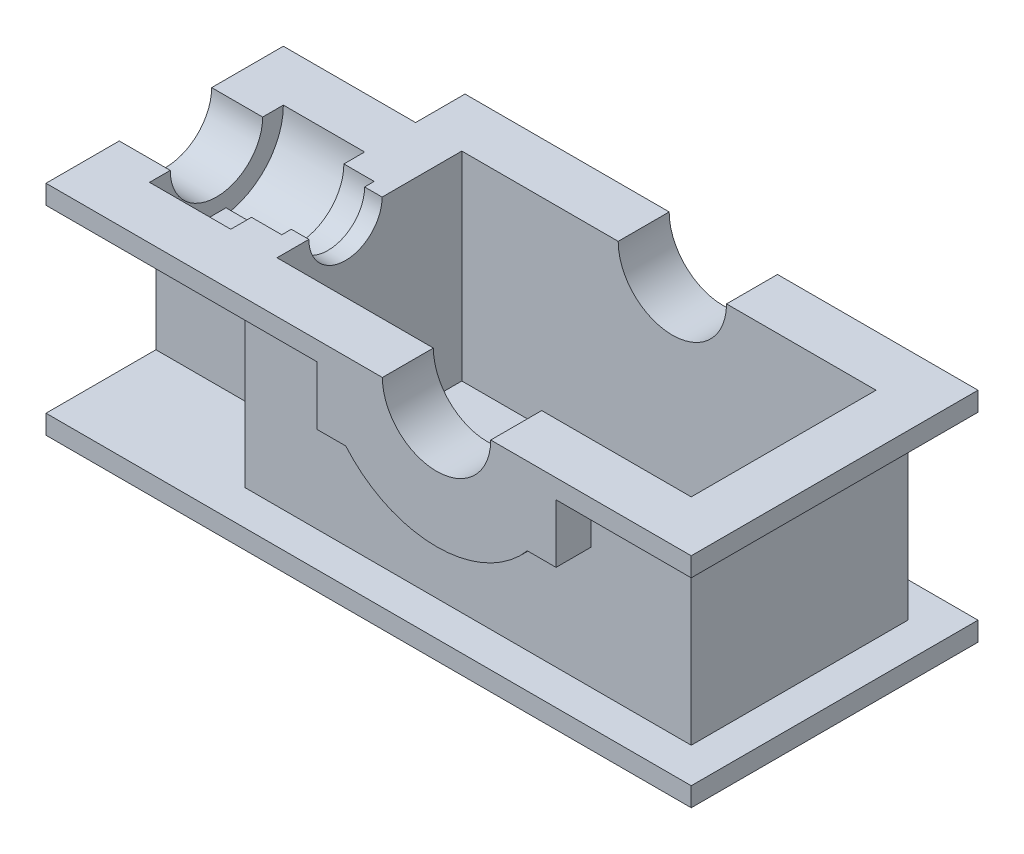
from build123d import *

# Parameters (mm, degrees)
EXTRUDE_1_DEPTH     = 12
SKETCH_2_W          = 150
SKETCH_2_H          = 32
SKETCH_2_W_2        = 30
SKETCH_2_H_2        = 98
SKETCH_2_W_3        = 32
EXTRUDE_2_DEPTH     = 250
SKETCH_3_R          = 34
CUT_EXTRUDE_1_DEPTH = 180
SKETCH_5_R          = 29
CUT_EXTRUDE_2_DEPTH = 102
SKETCH_7_R          = 23
CUT_EXTRUDE_3_DEPTH = 30
SKETCH_8_W          = 496.089150523
SKETCH_8_H          = 225.419588898
CUT_EXTRUDE_4_DEPTH = 125
EXTRUDE_4_DEPTH     = 12
EXTRUDE_5_DEPTH     = 125
EXTRUDE_6_DEPTH     = 83
CUT_EXTRUDE_5_DEPTH = 103
SKETCH_16_W         = 12
SKETCH_16_H         = 87.151966458
EXTRUDE_7_DEPTH     = 103
CUT_EXTRUDE_6_DEPTH = 22
CUT_EXTRUDE_START   = -22
CUT_EXTRUDE_7_DEPTH = 22


with BuildPart() as part:
    # Эскиз1 → Бобышка-Вытянуть1 (new body)
    with BuildSketch(Plane(origin=(0, 0, 0), x_dir=(1, 0, 0), z_dir=(0, 1, 0))):
        Polygon((0, 0), (313.861619332, 0), (313.861619332, 180), (-8.138380668, 180), (-8.138380668, 148.982), (-91.138380668, 148.982), (-91.138380668, 0), align=None)
    extrude(amount=EXTRUDE_1_DEPTH)

    # Эскиз2 → Бобышка-Вытянуть2 (add)
    with BuildSketch(Plane(origin=(0, 12, 0), x_dir=(1, 0, 0), z_dir=(0, 1, 0))):
        with Locations((154.012619332, 16)):
            Rectangle(SKETCH_2_W, SKETCH_2_H)
        with Locations((154.012619332, 164)):
            Rectangle(SKETCH_2_W, SKETCH_2_H)
        with Locations((6.861619332, 74.982)):
            Rectangle(SKETCH_2_W_2, SKETCH_2_H_2)
        with Locations((-75.138380668, 74.982)):
            Rectangle(SKETCH_2_W_3, SKETCH_2_H_2)
    extrude(amount=EXTRUDE_2_DEPTH)

    # Эскиз3 → Вырез-Вытянуть1 (cut)
    with BuildSketch(Plane.XY):
        with Locations((154.012619332, 137)):
            Circle(SKETCH_3_R)
    extrude(amount=-CUT_EXTRUDE_1_DEPTH, mode=Mode.SUBTRACT)

    # Эскиз5 → Вырез-Вытянуть2 (cut)
    with BuildSketch(Plane.ZY.offset(91.138380668)):
        with Locations((-74.982, 137)):
            Circle(SKETCH_5_R)
    extrude(amount=-CUT_EXTRUDE_2_DEPTH, mode=Mode.SUBTRACT)

    # Эскиз7 → Вырез-Вытянуть3 (cut)
    with BuildSketch(Plane(origin=(21.861619332, 0, 0), x_dir=(0, 0, -1), z_dir=(1, 0, 0))):
        with Locations((74.982, 137)):
            Circle(SKETCH_7_R)
    extrude(amount=-CUT_EXTRUDE_3_DEPTH, mode=Mode.SUBTRACT)

    # Эскиз8 → Вырез-Вытянуть4 (cut)
    with BuildSketch(Plane(origin=(0, 262, 0), x_dir=(1, 0, 0), z_dir=(0, 1, 0))):
        with Locations((147.686138723, 78.998859842)):
            Rectangle(SKETCH_8_W, SKETCH_8_H)
    extrude(amount=-CUT_EXTRUDE_4_DEPTH, mode=Mode.SUBTRACT)

    # Эскиз9 → Бобышка-Вытянуть4 (add)
    with BuildSketch(Plane(origin=(0, 137, 0), x_dir=(1, 0, 0), z_dir=(0, 1, 0))):
        Polygon((120.012619332, 0), (120.012619332, 32), (21.861619332, 32), (21.861619332, 32.982), (-91.138380668, 32.982), (-91.138380668, 0), align=None)
        Polygon((281.861619332, 32), (188.012619332, 32), (188.012619332, 0), (313.861619332, 0), (313.861619332, 180), (188.012619332, 180), (188.012619332, 148), (281.861619332, 148), align=None)
        Polygon((-8.138380668, 148.982), (-91.138380668, 148.982), (-91.138380668, 116.982), (21.861619332, 116.982), (21.861619332, 148), (120.012619332, 148), (120.012619332, 180), (-8.138380668, 180), align=None)
    extrude(amount=-EXTRUDE_4_DEPTH)

    # Эскиз10 → Бобышка-Вытянуть5 (add)
    with BuildSketch(Plane(origin=(0, 137, 0), x_dir=(1, 0, 0), z_dir=(0, 1, 0))):
        Polygon((21.861619332, 148), (120.012619332, 148), (120.012619332, 158), (11.861619332, 158), (11.861619332, 97.982), (21.861619332, 97.982), align=None)
        Polygon((21.861619332, 32), (21.861619332, 51.982), (11.861619332, 51.982), (11.861619332, 22), (120.012619332, 22), (120.012619332, 32), align=None)
        Polygon((281.861619332, 32), (188.012619332, 32), (188.012619332, 22), (291.861619332, 22), (291.861619332, 158), (188.012619332, 158), (188.012619332, 148), (281.861619332, 148), align=None)
    extrude(amount=-EXTRUDE_5_DEPTH)

    # Эскиз12 → Бобышка-Вытянуть6 (add)
    with BuildSketch(Plane.ZY.offset(91.138380668)):
        with BuildLine():
            Line((-121.982, 137), (-116.982, 137))
            ThreePointArc((-116.982, 137), (-74.982, 95), (-32.982, 137))
            Line((-32.982, 137), (-27.982, 137))
            ThreePointArc((-27.982, 137), (-74.982, 90), (-121.982, 137))
        make_face()
    extrude(amount=-EXTRUDE_6_DEPTH)

    # Эскиз14 → Вырез-Вытянуть5 (cut)
    with BuildSketch(Plane.ZY.offset(91.138380668)):
        with BuildLine():
            Line((-120.42427107, 125), (-123.982, 125))
            Line((-123.982, 125), (-123.982, 12))
            Line((-123.982, 12), (-25.982, 12))
            Line((-25.982, 12), (-25.982, 125))
            Line((-25.982, 125), (-29.53972893, 125))
            ThreePointArc((-29.53972893, 125), (-74.982, 90), (-120.42427107, 125))
        make_face()
    extrude(amount=-CUT_EXTRUDE_5_DEPTH, mode=Mode.SUBTRACT)

    # Эскиз16 → Бобышка-Вытянуть7 (add)
    with BuildSketch(Plane.ZY.offset(91.138380668)):
        with Locations((-74.982, 55.575983229)):
            Rectangle(SKETCH_16_W, SKETCH_16_H)
    extrude(amount=-EXTRUDE_7_DEPTH)

    # Эскиз17 → Вырез-Вытянуть6 (cut)
    with BuildSketch(Plane.XY):
        with BuildLine():
            Line((79.012619332, 12), (229.012619332, 12))
            Line((229.012619332, 12), (229.012619332, 88.255769572))
            Line((229.012619332, 88.255769572), (211.012619332, 88.255769572))
            ThreePointArc((211.012619332, 88.255769572), (154.012619332, 62), (97.012619332, 88.255769572))
            Line((97.012619332, 88.255769572), (79.012619332, 88.255769572))
            Line((79.012619332, 88.255769572), (79.012619332, 12))
        make_face()
    extrude(amount=-CUT_EXTRUDE_6_DEPTH, mode=Mode.SUBTRACT)

    # Эскиз18 → Вырез-Вытянуть7 (cut)
    with BuildSketch(Plane(origin=(0, 0, -180), x_dir=(-1, 0, 0), z_dir=(0, 0, -1)).offset(CUT_EXTRUDE_START)):
        with BuildLine():
            Line((-229.012619332, 12), (-79.012619332, 12))
            Line((-79.012619332, 12), (-79.012619332, 88.255769572))
            Line((-79.012619332, 88.255769572), (-97.012619332, 88.255769572))
            ThreePointArc((-97.012619332, 88.255769572), (-154.012619332, 62), (-211.012619332, 88.255769572))
            Line((-211.012619332, 88.255769572), (-229.012619332, 88.255769572))
            Line((-229.012619332, 88.255769572), (-229.012619332, 12))
        make_face()
    extrude(amount=CUT_EXTRUDE_7_DEPTH, mode=Mode.SUBTRACT)


solid = part.part
